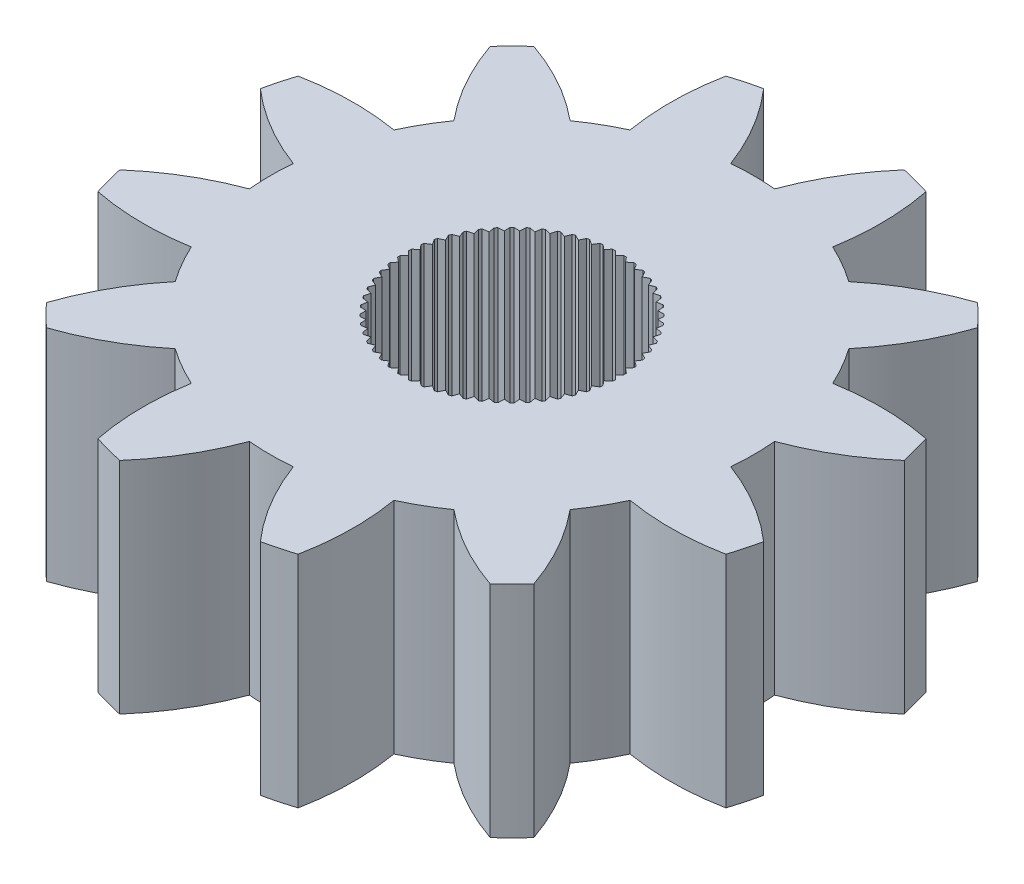
from build123d import *

# Parameters (mm, degrees)
SALIENTE_EXTRUIR1_DEPTH = 5


with BuildPart() as part:
    # Croquis2 → Saliente-Extruir1 (new body)
    with BuildSketch(Plane(origin=(0, 0, 0), x_dir=(1, 0, 0), z_dir=(0, 1, 0))):
        with BuildLine():
            ThreePointArc((60.700997121, 2.2780324), (59.626129307, 2.390018259), (58.548745797, 2.305600112))
            ThreePointArc((58.548745825, 2.305600124), (58.318469051, 2.750000039), (58.048745815, 3.171625528))
            ThreePointArc((58.048745797, 3.171625515), (58.660545812, 4.062457931), (59.100997121, 5.049313692))
            ThreePointArc((59.100997132, 5.049313703), (58.858630175, 5.303300895), (58.604642981, 5.545667848))
            ThreePointArc((58.604642963, 5.545667829), (57.617787201, 5.10521652), (56.726954786, 4.493416505))
            ThreePointArc((56.726954797, 4.493416522), (56.305329304, 4.763139749), (55.860929386, 4.993416514))
            ThreePointArc((55.860929382, 4.993416505), (55.945347529, 6.070800015), (55.83336167, 7.145667829))
            ThreePointArc((55.833361671, 7.145667831), (55.496472134, 7.244443712), (55.155329295, 7.327346053))
            ThreePointArc((55.155329292, 7.327346041), (54.520912787, 6.452476138), (54.055329292, 5.477225575))
            ThreePointArc((54.055329293, 5.477225581), (53.555329292, 5.5), (53.055329293, 5.47722557))
            ThreePointArc((53.055329292, 5.477225575), (52.589745798, 6.452476138), (51.955329292, 7.327346041))
            ThreePointArc((51.955329295, 7.327346028), (51.614186458, 7.244443682), (51.277296923, 7.145667796))
            ThreePointArc((51.277296922, 7.145667799), (51.165311063, 6.070799985), (51.249729211, 4.993416475))
            ThreePointArc((51.249729215, 4.993416466), (50.805329304, 4.763139693), (50.383703818, 4.493416459))
            ThreePointArc((50.383703807, 4.493416475), (49.492871392, 5.10521649), (48.50601563, 5.545667799))
            ThreePointArc((48.506015648, 5.545667779), (48.252028458, 5.303300823), (48.009661505, 5.04931363))
            ThreePointArc((48.009661494, 5.04931364), (48.450112802, 4.062457878), (49.061912817, 3.171625463))
            ThreePointArc((49.061912835, 3.171625451), (48.792189609, 2.749999961), (48.561912844, 2.305600047))
            ThreePointArc((48.561912817, 2.30560006), (47.484529308, 2.390018207), (46.409661494, 2.278032348))
            ThreePointArc((46.409661527, 2.278032338), (46.310885646, 1.941142802), (46.227983304, 1.599999965))
            ThreePointArc((46.227983282, 1.59999997), (47.102853185, 0.965583464), (48.078103747, 0.49999997))
            ThreePointArc((48.078103774, 0.499999967), (48.055329352, -3e-08), (48.07810378, -0.500000027))
            ThreePointArc((48.078103747, -0.50000003), (47.102853185, -0.965583525), (46.227983282, -1.60000003))
            Line((46.227983282, -1.60000003), (46.258611764, -1.734333569))
            ThreePointArc((46.258611796, -1.734333561), (46.329021453, -2.007604081), (46.409661545, -2.278032394))
            ThreePointArc((46.409661524, -2.2780324), (47.484529338, -2.390018259), (48.561912847, -2.305600112))
            ThreePointArc((48.561912869, -2.305600101), (48.792189639, -2.750000013), (49.061912869, -3.1716255))
            ThreePointArc((49.061912847, -3.171625515), (48.450112832, -4.062457931), (48.009661524, -5.049313692))
            ThreePointArc((48.009661545, -5.049313673), (48.252028499, -5.303300865), (48.506015691, -5.545667818))
            ThreePointArc((48.506015682, -5.545667829), (49.492871444, -5.10521652), (50.383703859, -4.493416505))
            ThreePointArc((50.383703867, -4.493416493), (50.805329356, -4.763139723), (51.249729269, -4.993416491))
            ThreePointArc((51.249729263, -4.993416505), (51.165311115, -6.070800015), (51.277296974, -7.145667829))
            ThreePointArc((51.277296979, -7.145667814), (51.614186514, -7.244443697), (51.955329352, -7.327346041))
            ThreePointArc((51.955329352, -7.327346041), (52.589745858, -6.452476138), (53.055329352, -5.477225575))
            ThreePointArc((53.055329352, -5.477225575), (53.555329352, -5.5), (54.055329352, -5.477225575))
            ThreePointArc((54.055329352, -5.477225575), (54.520912847, -6.452476138), (55.155329352, -7.327346041))
            ThreePointArc((55.155329352, -7.327346041), (55.496472191, -7.244443697), (55.833361727, -7.145667813))
            ThreePointArc((55.833361723, -7.145667799), (55.945347581, -6.070799985), (55.860929434, -4.993416475))
            ThreePointArc((55.86092944, -4.993416489), (56.305329356, -4.763139719), (56.726954846, -4.493416487))
            ThreePointArc((56.726954838, -4.493416475), (57.617787253, -5.10521649), (58.604643015, -5.545667799))
            ThreePointArc((58.604643024, -5.545667809), (58.858630217, -5.303300853), (59.100997172, -5.04931366))
            ThreePointArc((59.100997151, -5.04931364), (58.660545842, -4.062457878), (58.048745828, -3.171625463))
            ThreePointArc((58.04874585, -3.171625479), (58.318469081, -2.749999987), (58.54874585, -2.30560007))
            ThreePointArc((58.548745828, -2.30560006), (59.626129337, -2.390018207), (60.700997151, -2.278032348))
            ThreePointArc((60.700997172, -2.278032355), (60.799773055, -1.941142817), (60.882675398, -1.599999978))
            ThreePointArc((60.882675363, -1.59999997), (60.00780546, -0.965583464), (59.032554897, -0.49999997))
            ThreePointArc((59.03255493, -0.499999973), (59.055329352, 3e-08), (59.032554924, 0.500000033))
            ThreePointArc((59.032554897, 0.50000003), (60.00780546, 0.965583525), (60.882675363, 1.60000003))
            Line((60.882675363, 1.60000003), (60.700997121, 2.2780324))
        make_face()
        with BuildLine():
            ThreePointArc((54.160200358, 2.374159023), (54.189436013, 2.366518274), (54.218575207, 2.358517529))
            Line((54.218575207, 2.358517529), (54.281519289, 2.234982813))
            Line((54.281519289, 2.234982813), (54.405054005, 2.297926895))
            ThreePointArc((54.405054005, 2.297926895), (54.433330829, 2.287272045), (54.46147409, 2.276269253))
            Line((54.46147409, 2.276269253), (54.511160464, 2.146831825))
            Line((54.511160464, 2.146831825), (54.640597892, 2.196518199))
            ThreePointArc((54.640597892, 2.196518199), (54.667606077, 2.182965984), (54.694445062, 2.169081695))
            Line((54.694445062, 2.169081695), (54.730329352, 2.035159699))
            Line((54.730329352, 2.035159699), (54.864251349, 2.07104399))
            ThreePointArc((54.864251349, 2.07104399), (54.889694988, 2.054742891), (54.914935643, 2.038129224))
            Line((54.914935643, 2.038129224), (54.936624695, 1.901189937))
            Line((54.936624695, 1.901189937), (55.073563983, 1.922878989))
            ThreePointArc((55.073563983, 1.922878989), (55.09716431, 1.904007606), (55.120530093, 1.884846583))
            Line((55.120530093, 1.884846583), (55.127786277, 1.74639034))
            Line((55.127786277, 1.74639034), (55.26624252, 1.753646524))
            ThreePointArc((55.26624252, 1.753646524), (55.287740966, 1.732411614), (55.308975876, 1.710913168))
            Line((55.308975876, 1.710913168), (55.301719692, 1.572456925))
            Line((55.301719692, 1.572456925), (55.440175935, 1.565200741))
            ThreePointArc((55.440175935, 1.565200741), (55.459336958, 1.541834958), (55.478208342, 1.51823463))
            Line((55.478208342, 1.51823463), (55.456519289, 1.381295343))
            Line((55.456519289, 1.381295343), (55.593458577, 1.35960629))
            ThreePointArc((55.593458577, 1.35960629), (55.610072244, 1.334365636), (55.626373342, 1.308921996))
            Line((55.626373342, 1.308921996), (55.590489051, 1.175))
            Line((55.590489051, 1.175), (55.724411048, 1.139115709))
            ThreePointArc((55.724411048, 1.139115709), (55.738295337, 1.112276724), (55.751847551, 1.085268539))
            Line((55.751847551, 1.085268539), (55.702161178, 0.955831111))
            Line((55.702161178, 0.955831111), (55.831598606, 0.906144738))
            ThreePointArc((55.831598606, 0.906144738), (55.842601397, 0.878001476), (55.853256247, 0.849724653))
            Line((55.853256247, 0.849724653), (55.790312166, 0.726189937))
            Line((55.790312166, 0.726189937), (55.913846882, 0.663245855))
            ThreePointArc((55.913846882, 0.663245855), (55.921847627, 0.634106661), (55.929488376, 0.604871005))
            Line((55.929488376, 0.604871005), (55.853976214, 0.488592473))
            Line((55.853976214, 0.488592473), (55.970254746, 0.413080312))
            ThreePointArc((55.970254746, 0.413080312), (55.975165787, 0.383264439), (55.979708721, 0.353390264))
            Line((55.979708721, 0.353390264), (55.892455806, 0.245641889))
            Line((55.892455806, 0.245641889), (56.000204182, 0.158388975))
            ThreePointArc((56.000204182, 0.158388975), (56.001971713, 0.128223093), (56.003367058, 0.098037706))
            Line((56.003367058, 0.098037706), (55.905329352, 0))
            Line((55.905329352, 0), (56.003367058, -0.098037706))
            ThreePointArc((56.003367058, -0.098037706), (56.001971713, -0.128223093), (56.000204182, -0.158388975))
            Line((56.000204182, -0.158388975), (55.892455806, -0.245641889))
            Line((55.892455806, -0.245641889), (55.979708721, -0.353390264))
            ThreePointArc((55.979708721, -0.353390264), (55.975165787, -0.383264439), (55.970254746, -0.413080312))
            Line((55.970254746, -0.413080312), (55.853976214, -0.488592473))
            Line((55.853976214, -0.488592473), (55.929488376, -0.604871005))
            ThreePointArc((55.929488376, -0.604871005), (55.921847627, -0.634106661), (55.913846882, -0.663245855))
            Line((55.913846882, -0.663245855), (55.790312166, -0.726189937))
            Line((55.790312166, -0.726189937), (55.853256247, -0.849724653))
            ThreePointArc((55.853256247, -0.849724653), (55.842601397, -0.878001476), (55.831598606, -0.906144738))
            Line((55.831598606, -0.906144738), (55.702161178, -0.955831111))
            Line((55.702161178, -0.955831111), (55.751847551, -1.085268539))
            ThreePointArc((55.751847551, -1.085268539), (55.738295337, -1.112276724), (55.724411048, -1.139115709))
            Line((55.724411048, -1.139115709), (55.590489051, -1.175))
            Line((55.590489051, -1.175), (55.626373342, -1.308921996))
            ThreePointArc((55.626373342, -1.308921996), (55.610072244, -1.334365636), (55.593458577, -1.35960629))
            Line((55.593458577, -1.35960629), (55.456519289, -1.381295343))
            Line((55.456519289, -1.381295343), (55.478208342, -1.51823463))
            ThreePointArc((55.478208342, -1.51823463), (55.459336958, -1.541834958), (55.440175935, -1.565200741))
            Line((55.440175935, -1.565200741), (55.301719692, -1.572456925))
            Line((55.301719692, -1.572456925), (55.308975876, -1.710913168))
            ThreePointArc((55.308975876, -1.710913168), (55.287740966, -1.732411614), (55.26624252, -1.753646524))
            Line((55.26624252, -1.753646524), (55.127786277, -1.74639034))
            Line((55.127786277, -1.74639034), (55.120530093, -1.884846583))
            ThreePointArc((55.120530093, -1.884846583), (55.09716431, -1.904007606), (55.073563983, -1.922878989))
            Line((55.073563983, -1.922878989), (54.936624695, -1.901189937))
            Line((54.936624695, -1.901189937), (54.914935643, -2.038129224))
            ThreePointArc((54.914935643, -2.038129224), (54.889694988, -2.054742891), (54.864251349, -2.07104399))
            Line((54.864251349, -2.07104399), (54.730329352, -2.035159699))
            Line((54.730329352, -2.035159699), (54.694445062, -2.169081695))
            ThreePointArc((54.694445062, -2.169081695), (54.667606077, -2.182965984), (54.640597892, -2.196518199))
            Line((54.640597892, -2.196518199), (54.511160464, -2.146831825))
            Line((54.511160464, -2.146831825), (54.46147409, -2.276269253))
            ThreePointArc((54.46147409, -2.276269253), (54.433330829, -2.287272045), (54.405054005, -2.297926895))
            Line((54.405054005, -2.297926895), (54.281519289, -2.234982813))
            Line((54.281519289, -2.234982813), (54.218575207, -2.358517529))
            ThreePointArc((54.218575207, -2.358517529), (54.189436013, -2.366518274), (54.160200358, -2.374159023))
            Line((54.160200358, -2.374159023), (54.043921826, -2.298646862))
            Line((54.043921826, -2.298646862), (53.968409664, -2.414925393))
            ThreePointArc((53.968409664, -2.414925393), (53.938593792, -2.419836434), (53.908719617, -2.424379368))
            Line((53.908719617, -2.424379368), (53.800971241, -2.337126454))
            Line((53.800971241, -2.337126454), (53.713718327, -2.44487483))
            ThreePointArc((53.713718327, -2.44487483), (53.683552445, -2.44664236), (53.653367058, -2.448037706))
            Line((53.653367058, -2.448037706), (53.555329352, -2.35))
            Line((53.555329352, -2.35), (53.457291647, -2.448037706))
            ThreePointArc((53.457291647, -2.448037706), (53.42710626, -2.44664236), (53.396940378, -2.44487483))
            Line((53.396940378, -2.44487483), (53.309687464, -2.337126454))
            Line((53.309687464, -2.337126454), (53.201939088, -2.424379368))
            ThreePointArc((53.201939088, -2.424379368), (53.172064913, -2.419836434), (53.14224904, -2.414925393))
            Line((53.14224904, -2.414925393), (53.066736879, -2.298646862))
            Line((53.066736879, -2.298646862), (52.950458347, -2.374159023))
            ThreePointArc((52.950458347, -2.374159023), (52.921222692, -2.366518274), (52.892083497, -2.358517529))
            Line((52.892083497, -2.358517529), (52.829139416, -2.234982813))
            Line((52.829139416, -2.234982813), (52.7056047, -2.297926895))
            ThreePointArc((52.7056047, -2.297926895), (52.677327876, -2.287272045), (52.649184615, -2.276269253))
            Line((52.649184615, -2.276269253), (52.599498241, -2.146831825))
            Line((52.599498241, -2.146831825), (52.470060813, -2.196518199))
            ThreePointArc((52.470060813, -2.196518199), (52.443052628, -2.182965984), (52.416213643, -2.169081695))
            Line((52.416213643, -2.169081695), (52.380329352, -2.035159699))
            Line((52.380329352, -2.035159699), (52.246407356, -2.07104399))
            ThreePointArc((52.246407356, -2.07104399), (52.220963717, -2.054742891), (52.195723062, -2.038129224))
            Line((52.195723062, -2.038129224), (52.174034009, -1.901189937))
            Line((52.174034009, -1.901189937), (52.037094722, -1.922878989))
            ThreePointArc((52.037094722, -1.922878989), (52.013494394, -1.904007606), (51.990128612, -1.884846583))
            Line((51.990128612, -1.884846583), (51.982872427, -1.74639034))
            Line((51.982872427, -1.74639034), (51.844416184, -1.753646524))
            ThreePointArc((51.844416184, -1.753646524), (51.822917738, -1.732411614), (51.801682828, -1.710913168))
            Line((51.801682828, -1.710913168), (51.808939013, -1.572456925))
            Line((51.808939013, -1.572456925), (51.670482769, -1.565200741))
            ThreePointArc((51.670482769, -1.565200741), (51.651321747, -1.541834958), (51.632450363, -1.51823463))
            Line((51.632450363, -1.51823463), (51.654139416, -1.381295343))
            Line((51.654139416, -1.381295343), (51.517200128, -1.35960629))
            ThreePointArc((51.517200128, -1.35960629), (51.500586461, -1.334365636), (51.484285363, -1.308921996))
            Line((51.484285363, -1.308921996), (51.520169653, -1.175))
            Line((51.520169653, -1.175), (51.386247657, -1.139115709))
            ThreePointArc((51.386247657, -1.139115709), (51.372363368, -1.112276724), (51.358811154, -1.085268539))
            Line((51.358811154, -1.085268539), (51.408497527, -0.955831111))
            Line((51.408497527, -0.955831111), (51.279060099, -0.906144738))
            ThreePointArc((51.279060099, -0.906144738), (51.268057307, -0.878001476), (51.257402457, -0.849724653))
            Line((51.257402457, -0.849724653), (51.320346539, -0.726189937))
            Line((51.320346539, -0.726189937), (51.196811823, -0.663245855))
            ThreePointArc((51.196811823, -0.663245855), (51.188811078, -0.634106661), (51.181170329, -0.604871005))
            Line((51.181170329, -0.604871005), (51.256682491, -0.488592473))
            Line((51.256682491, -0.488592473), (51.140403959, -0.413080312))
            ThreePointArc((51.140403959, -0.413080312), (51.135492918, -0.383264439), (51.130949984, -0.353390264))
            Line((51.130949984, -0.353390264), (51.218202898, -0.245641889))
            Line((51.218202898, -0.245641889), (51.110454523, -0.158388975))
            ThreePointArc((51.110454523, -0.158388975), (51.108686992, -0.128223093), (51.107291647, -0.098037706))
            Line((51.107291647, -0.098037706), (51.205329352, 0))
            Line((51.205329352, 0), (51.107291647, 0.098037706))
            ThreePointArc((51.107291647, 0.098037706), (51.108686992, 0.128223093), (51.110454523, 0.158388975))
            Line((51.110454523, 0.158388975), (51.218202898, 0.245641889))
            Line((51.218202898, 0.245641889), (51.130949984, 0.353390264))
            ThreePointArc((51.130949984, 0.353390264), (51.135492918, 0.383264439), (51.140403959, 0.413080312))
            Line((51.140403959, 0.413080312), (51.256682491, 0.488592473))
            Line((51.256682491, 0.488592473), (51.181170329, 0.604871005))
            ThreePointArc((51.181170329, 0.604871005), (51.188811078, 0.634106661), (51.196811823, 0.663245855))
            Line((51.196811823, 0.663245855), (51.320346539, 0.726189937))
            Line((51.320346539, 0.726189937), (51.257402457, 0.849724653))
            ThreePointArc((51.257402457, 0.849724653), (51.268057307, 0.878001476), (51.279060099, 0.906144738))
            Line((51.279060099, 0.906144738), (51.408497527, 0.955831111))
            Line((51.408497527, 0.955831111), (51.358811154, 1.085268539))
            ThreePointArc((51.358811154, 1.085268539), (51.372363368, 1.112276724), (51.386247657, 1.139115709))
            Line((51.386247657, 1.139115709), (51.520169653, 1.175))
            Line((51.520169653, 1.175), (51.484285363, 1.308921996))
            ThreePointArc((51.484285363, 1.308921996), (51.500586461, 1.334365636), (51.517200128, 1.35960629))
            Line((51.517200128, 1.35960629), (51.654139416, 1.381295343))
            Line((51.654139416, 1.381295343), (51.632450363, 1.51823463))
            ThreePointArc((51.632450363, 1.51823463), (51.651321747, 1.541834958), (51.670482769, 1.565200741))
            Line((51.670482769, 1.565200741), (51.808939013, 1.572456925))
            Line((51.808939013, 1.572456925), (51.801682828, 1.710913168))
            ThreePointArc((51.801682828, 1.710913168), (51.822917738, 1.732411614), (51.844416184, 1.753646524))
            Line((51.844416184, 1.753646524), (51.982872427, 1.74639034))
            Line((51.982872427, 1.74639034), (51.990128612, 1.884846583))
            ThreePointArc((51.990128612, 1.884846583), (52.013494394, 1.904007606), (52.037094722, 1.922878989))
            Line((52.037094722, 1.922878989), (52.174034009, 1.901189937))
            Line((52.174034009, 1.901189937), (52.195723062, 2.038129224))
            ThreePointArc((52.195723062, 2.038129224), (52.220963717, 2.054742891), (52.246407356, 2.07104399))
            Line((52.246407356, 2.07104399), (52.380329352, 2.035159699))
            Line((52.380329352, 2.035159699), (52.416213643, 2.169081695))
            ThreePointArc((52.416213643, 2.169081695), (52.443052628, 2.182965984), (52.470060813, 2.196518199))
            Line((52.470060813, 2.196518199), (52.599498241, 2.146831825))
            Line((52.599498241, 2.146831825), (52.649184615, 2.276269253))
            ThreePointArc((52.649184615, 2.276269253), (52.677327876, 2.287272045), (52.7056047, 2.297926895))
            Line((52.7056047, 2.297926895), (52.829139416, 2.234982813))
            Line((52.829139416, 2.234982813), (52.892083497, 2.358517529))
            ThreePointArc((52.892083497, 2.358517529), (52.921222692, 2.366518274), (52.950458347, 2.374159023))
            Line((52.950458347, 2.374159023), (53.066736879, 2.298646862))
            Line((53.066736879, 2.298646862), (53.14224904, 2.414925393))
            ThreePointArc((53.14224904, 2.414925393), (53.172064913, 2.419836434), (53.201939088, 2.424379368))
            Line((53.201939088, 2.424379368), (53.309687464, 2.337126454))
            Line((53.309687464, 2.337126454), (53.396940378, 2.44487483))
            ThreePointArc((53.396940378, 2.44487483), (53.42710626, 2.44664236), (53.457291647, 2.448037706))
            Line((53.457291647, 2.448037706), (53.555329352, 2.35))
            Line((53.555329352, 2.35), (53.653367058, 2.448037706))
            ThreePointArc((53.653367058, 2.448037706), (53.683552445, 2.44664236), (53.713718327, 2.44487483))
            Line((53.713718327, 2.44487483), (53.800971241, 2.337126454))
            Line((53.800971241, 2.337126454), (53.908719617, 2.424379368))
            ThreePointArc((53.908719617, 2.424379368), (53.938593792, 2.419836434), (53.968409664, 2.414925393))
            Line((53.968409664, 2.414925393), (54.043921826, 2.298646862))
            Line((54.043921826, 2.298646862), (54.160200358, 2.374159023))
        make_face(mode=Mode.SUBTRACT)
    extrude(amount=-SALIENTE_EXTRUIR1_DEPTH)


solid = part.part
